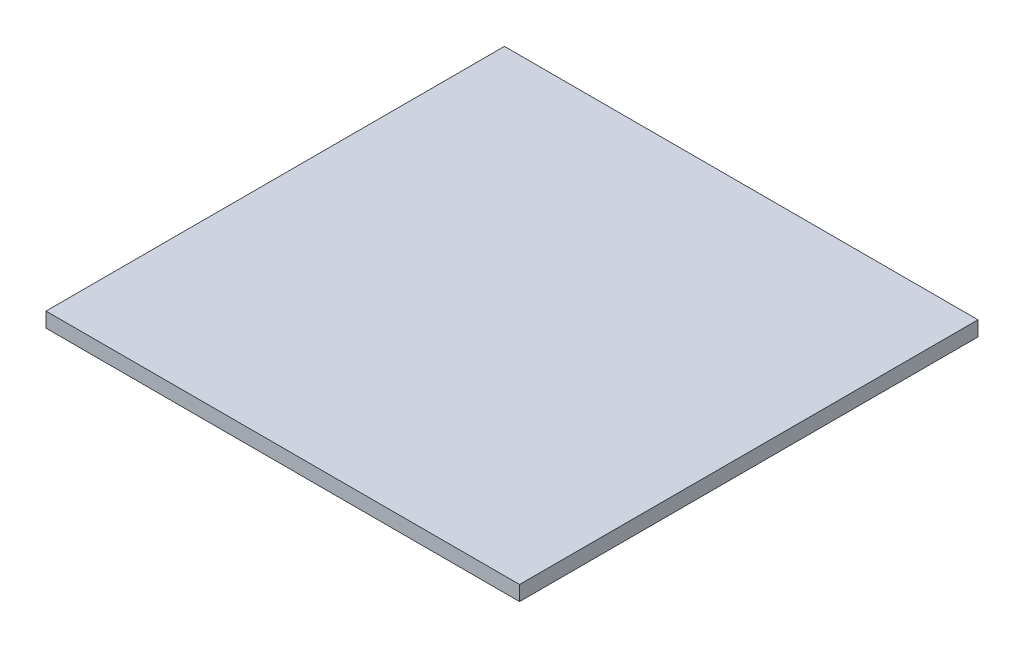
from build123d import *

# Parameters (mm, degrees)
SKETCH1_W           = 102.06
SKETCH1_H           = 98.8
BOSS_EXTRUDE1_DEPTH = 3.2


with BuildPart() as part:
    # Sketch1 → Boss-Extrude1 (new body)
    with BuildSketch(Plane(origin=(0, 0, 0), x_dir=(1, 0, 0), z_dir=(0, 1, 0))):
        with Locations((6.748457944, -28.701985981)):
            Rectangle(SKETCH1_W, SKETCH1_H)
    extrude(amount=BOSS_EXTRUDE1_DEPTH)


solid = part.part
